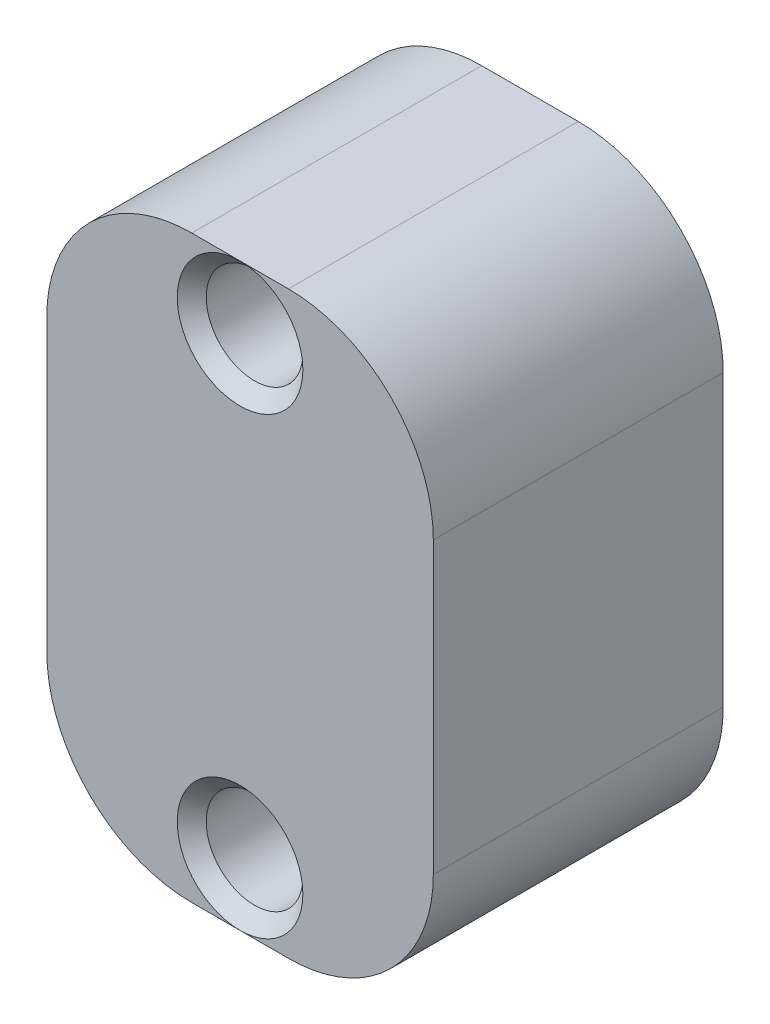
from build123d import *

# Parameters (mm, degrees)
CROQUIS1_R              = 2.5
BRIDA_BASE1_DEPTH       = 15
REDONDEO1_R             = 7.5
CHAFL_N1_SIZE           = 0.75
SALIENTE_EXTRUIR1_DEPTH = 5
REDONDEO2_R             = 1


# Sheet-metal steps are written as plain solids
with BuildPart() as part:
    # Croquis1 → Brida base1 (new body)
    with BuildSketch(Plane.XY):
        with BuildLine():
            Line((0, 30), (0, 18))
            Line((0, 18), (14, 18))
            ThreePointArc((14, 18), (17, 15), (14, 12))
            Line((14, 12), (0, 12))
            Line((0, 12), (0, 0))
            Line((0, 0), (20, 0))
            Line((20, 0), (20, 30))
            Line((20, 30), (0, 30))
        make_face()
        with Locations(Location((10, 3.25, 0), (0, 0, 180))):
            Circle(CROQUIS1_R, mode=Mode.SUBTRACT)
        with Locations((10, 26.75)):
            Circle(CROQUIS1_R, mode=Mode.SUBTRACT)
    extrude(amount=-BRIDA_BASE1_DEPTH)

    # Redondeo1
    redondeo1_edges = [part.edges().sort_by_distance(p)[0] for p in [
        (0, 30, -7.5),
        (20, 30, -7.5),
        (20, 0, -7.5),
        (0, 0, -7.5),
    ]]
    fillet(redondeo1_edges, radius=REDONDEO1_R)

    # Chaflán1
    chafl_n1_edges = [part.edges().sort_by_distance(p)[0] for p in [
        (7, 18, -15),
        (12.5, 3.25, -15),
        (12.5, 3.25, 0),
        (17, 15, -15),
        (7.5, 26.75, -15),
        (7.5, 26.75, 0),
        (7, 12, -15),
    ]]
    chamfer(chafl_n1_edges, length=CHAFL_N1_SIZE - 0.0001)  # a hair under: the kernel refuses the full size

    # Croquis2 → Saliente-Extruir1 (add)
    with BuildSketch(Plane(origin=(0, 0, 0), x_dir=(-1, 0, 0), z_dir=(0, 0, -1))):
        with BuildLine():
            Line((0, 18), (-14, 18))
            ThreePointArc((-14, 18), (-17, 15), (-14, 12))
            Line((-14, 12), (0, 12))
            Line((0, 12), (0, 18))
        make_face()
    extrude(amount=SALIENTE_EXTRUIR1_DEPTH)

    # Redondeo2
    redondeo2_edges = [part.edges().sort_by_distance(p)[0] for p in [
        (7, 18, -5),
        (17, 15, -5),
        (7, 12, -5),
    ]]
    fillet(redondeo2_edges, radius=REDONDEO2_R)


solid = part.part
